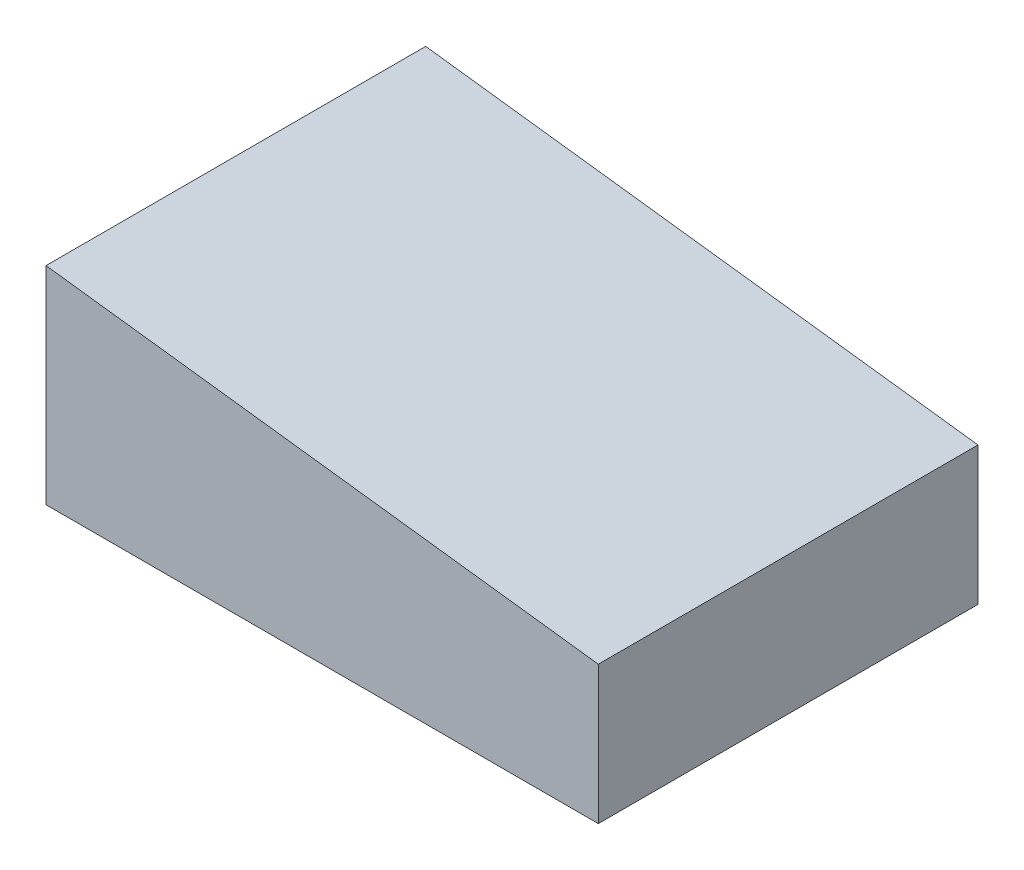
from build123d import *

# Parameters (mm, degrees)
EXTRUDE_1_DEPTH = 5.5


with BuildPart() as part:
    # ｽｹｯﾁ1 → ﾎﾞｽ - 押し出し1 (new body)
    with BuildSketch(Plane.XY):
        Polygon((0, 0), (8, 0), (8, 2), (0, 3), align=None)
    extrude(amount=EXTRUDE_1_DEPTH)


solid = part.part
